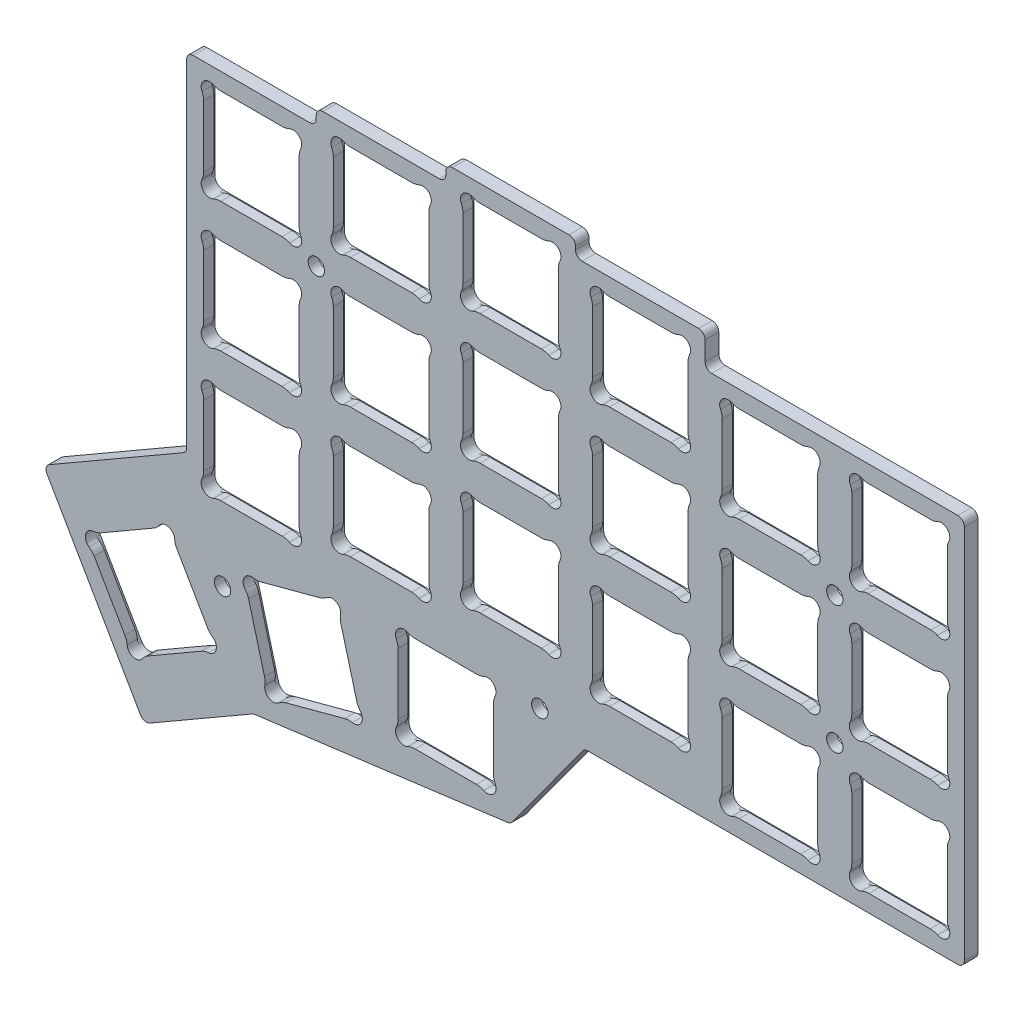
from build123d import *

# Parameters (mm, degrees)
SKETCH2_R           = 1.2
BOSS_EXTRUDE1_DEPTH = 2
FILLET1_R           = 2.5
SKETCH3_R           = 2
CUT_EXTRUDE1_DEPTH  = 0.5


with BuildPart() as part:
    # Sketch2 → Boss-Extrude1 (new body)
    with BuildSketch(Plane.XY):
        with BuildLine():
            ThreePointArc((3.358715952, 91.42556159), (2.678391323, 91.143761902), (2.396591635, 90.463437274))
            Line((2.396591635, 90.463437274), (2.396591635, 35.387693174))
            ThreePointArc((2.396591635, 35.387693174), (2.678391323, 34.707368546), (3.358715952, 34.425568858))
            Line((3.358715952, 34.425568858), (57.55538108, 34.425568858))
            ThreePointArc((57.55538108, 34.425568858), (57.991412266, 34.32109249), (58.332746845, 34.030353412))
            Line((58.332746845, 34.030353412), (68.6731028, 19.851286658))
            ThreePointArc((68.6731028, 19.851286658), (68.959916761, 19.590522811), (69.326358752, 19.464109602))
            Line((69.326358752, 19.464109602), (106.42211034, 14.638604201))
            ThreePointArc((106.42211034, 14.638604201), (106.606561986, 14.595821202), (106.779062685, 14.517742374))
            Line((106.779062685, 14.517742374), (121.831200494, 5.827386558))
            ThreePointArc((121.831200494, 5.827386558), (122.561278749, 5.731269932), (123.145486752, 6.1795485))
            Line((123.145486752, 6.1795485), (136.883362434, 29.974247168))
            ThreePointArc((136.883362434, 29.974247168), (136.979479059, 30.704325424), (136.531200492, 31.288533426))
            Line((136.531200492, 31.288533426), (116.881014221, 42.63357376))
            ThreePointArc((116.881014221, 42.63357376), (116.52885228, 42.985735701), (116.399952063, 43.466797859))
            Line((116.399952063, 43.466797859), (116.399952063, 92.828345033))
            ThreePointArc((116.399952063, 92.828345033), (116.118152375, 93.508669661), (115.437827746, 93.790469349))
            Line((115.437827746, 93.790469349), (98.360317754, 93.790469349))
            ThreePointArc((98.360317754, 93.790469349), (97.679993126, 94.072269037), (97.398193438, 94.752593666))
            Line((97.398193438, 94.752593666), (97.398193438, 95.213192117))
            ThreePointArc((97.398193438, 95.213192117), (97.11639375, 95.893516746), (96.436069121, 96.175316434))
            Line((96.436069121, 96.175316434), (79.359092742, 96.175316434))
            ThreePointArc((79.359092742, 96.175316434), (78.678768113, 96.457116122), (78.396968425, 97.137440751))
            Line((78.396968425, 97.137440751), (78.396968425, 97.587767164))
            ThreePointArc((78.396968425, 97.587767164), (78.115168737, 98.268091793), (77.434844109, 98.54989148))
            Line((77.434844109, 98.54989148), (60.359092745, 98.54989148))
            ThreePointArc((60.359092745, 98.54989148), (59.678768117, 98.268091793), (59.396968429, 97.587767164))
            Line((59.396968429, 97.587767164), (59.396968429, 97.133171852))
            ThreePointArc((59.396968429, 97.133171852), (59.115168741, 96.452847223), (58.434844112, 96.171047535))
            Line((58.434844112, 96.171047535), (41.357156249, 96.171047535))
            ThreePointArc((41.357156249, 96.171047535), (40.676831621, 95.889247847), (40.395031933, 95.208923218))
            Line((40.395031933, 95.208923218), (40.395031933, 92.387685907))
            ThreePointArc((40.395031933, 92.387685907), (40.113232245, 91.707361278), (39.432907616, 91.42556159))
            Line((39.432907616, 91.42556159), (3.358715952, 91.42556159))
        make_face()
        with BuildLine():
            ThreePointArc((17.128824679, 50.925568854), (18.012708155, 51.291685378), (18.896591632, 50.925568854))
            ThreePointArc((18.896591632, 50.925568854), (19.167557571, 50.520039668), (19.262708155, 50.041685378))
            ThreePointArc((19.262708155, 50.041685378), (19.167557571, 49.563331087), (18.896591632, 49.157801901))
            Line((18.896591632, 49.157801901), (18.896591632, 38.693335811))
            ThreePointArc((18.896591632, 38.693335811), (19.167557571, 38.287806624), (19.262708155, 37.809452334))
            ThreePointArc((19.262708155, 37.809452334), (19.167557571, 37.331098044), (18.896591632, 36.925568858))
            ThreePointArc((18.896591632, 36.925568858), (18.012708155, 36.559452334), (17.128824679, 36.925568858))
            Line((17.128824679, 36.925568858), (6.664358588, 36.925568858))
            ThreePointArc((6.664358588, 36.925568858), (5.780475112, 36.559452334), (4.896591635, 36.925568858))
            ThreePointArc((4.896591635, 36.925568858), (4.530475112, 37.809452334), (4.896591635, 38.693335811))
            Line((4.896591635, 38.693335811), (4.896591635, 49.157801901))
            ThreePointArc((4.896591635, 49.157801901), (4.530475112, 50.041685378), (4.896591635, 50.925568854))
            ThreePointArc((4.896591635, 50.925568854), (5.780475112, 51.291685378), (6.664358588, 50.925568854))
            Line((6.664358588, 50.925568854), (17.128824679, 50.925568854))
        make_face(mode=Mode.SUBTRACT)
        with BuildLine():
            ThreePointArc((25.662529929, 36.92624031), (24.778646452, 36.560123786), (23.894762976, 36.92624031))
            ThreePointArc((23.894762976, 36.92624031), (23.528646452, 37.810123786), (23.894762976, 38.694007263))
            Line((23.894762976, 38.694007263), (23.894762976, 49.158473353))
            ThreePointArc((23.894762976, 49.158473353), (23.528646452, 50.04235683), (23.894762976, 50.926240306))
            ThreePointArc((23.894762976, 50.926240306), (24.778646452, 51.29235683), (25.662529929, 50.926240306))
            Line((25.662529929, 50.926240306), (36.126996019, 50.926240306))
            ThreePointArc((36.126996019, 50.926240306), (37.010879496, 51.29235683), (37.894762972, 50.926240306))
            ThreePointArc((37.894762972, 50.926240306), (38.165728911, 50.52071112), (38.260879496, 50.04235683))
            ThreePointArc((38.260879496, 50.04235683), (38.165728911, 49.564002539), (37.894762972, 49.158473353))
            Line((37.894762972, 49.158473353), (37.894762972, 38.694007263))
            ThreePointArc((37.894762972, 38.694007263), (38.165728911, 38.288478077), (38.260879496, 37.810123786))
            ThreePointArc((38.260879496, 37.810123786), (38.165728911, 37.331769496), (37.894762972, 36.92624031))
            ThreePointArc((37.894762972, 36.92624031), (37.010879496, 36.560123786), (36.126996019, 36.92624031))
            Line((36.126996019, 36.92624031), (25.662529929, 36.92624031))
        make_face(mode=Mode.SUBTRACT)
        with Locations((64.637863533, 36.300090173)):
            Circle(SKETCH2_R, mode=Mode.SUBTRACT)
        with BuildLine():
            ThreePointArc((44.662798886, 41.671054802), (43.778915409, 41.304938279), (42.895031933, 41.671054802))
            ThreePointArc((42.895031933, 41.671054802), (42.528915409, 42.554938279), (42.895031933, 43.438821755))
            Line((42.895031933, 43.438821755), (42.895031933, 53.903287846))
            ThreePointArc((42.895031933, 53.903287846), (42.528915409, 54.787171322), (42.895031933, 55.671054799))
            ThreePointArc((42.895031933, 55.671054799), (43.778915409, 56.037171322), (44.662798886, 55.671054799))
            Line((44.662798886, 55.671054799), (55.127264976, 55.671054799))
            ThreePointArc((55.127264976, 55.671054799), (56.011148453, 56.037171322), (56.895031929, 55.671054799))
            ThreePointArc((56.895031929, 55.671054799), (57.165997868, 55.265525613), (57.261148453, 54.787171322))
            ThreePointArc((57.261148453, 54.787171322), (57.165997868, 54.308817032), (56.895031929, 53.903287846))
            Line((56.895031929, 53.903287846), (56.895031929, 43.438821755))
            ThreePointArc((56.895031929, 43.438821755), (57.165997868, 43.033292569), (57.261148453, 42.554938279))
            ThreePointArc((57.261148453, 42.554938279), (57.165997868, 42.076583988), (56.895031929, 41.671054802))
            ThreePointArc((56.895031929, 41.671054802), (56.011148453, 41.304938279), (55.127264976, 41.671054802))
            Line((55.127264976, 41.671054802), (44.662798886, 41.671054802))
        make_face(mode=Mode.SUBTRACT)
        with BuildLine():
            ThreePointArc((63.664735382, 44.049898748), (62.780851905, 43.683782224), (61.896968429, 44.049898748))
            ThreePointArc((61.896968429, 44.049898748), (61.530851905, 44.933782224), (61.896968429, 45.817665701))
            Line((61.896968429, 45.817665701), (61.896968429, 56.282131791))
            ThreePointArc((61.896968429, 56.282131791), (61.530851905, 57.166015268), (61.896968429, 58.049898744))
            ThreePointArc((61.896968429, 58.049898744), (62.780851905, 58.416015268), (63.664735382, 58.049898744))
            Line((63.664735382, 58.049898744), (74.129201472, 58.049898744))
            ThreePointArc((74.129201472, 58.049898744), (75.013084949, 58.416015268), (75.896968425, 58.049898744))
            ThreePointArc((75.896968425, 58.049898744), (76.167934364, 57.644369558), (76.263084949, 57.166015268))
            ThreePointArc((76.263084949, 57.166015268), (76.167934364, 56.687660977), (75.896968425, 56.282131791))
            Line((75.896968425, 56.282131791), (75.896968425, 45.817665701))
            ThreePointArc((75.896968425, 45.817665701), (76.167934364, 45.412136515), (76.263084949, 44.933782224))
            ThreePointArc((76.263084949, 44.933782224), (76.167934364, 44.455427934), (75.896968425, 44.049898748))
            ThreePointArc((75.896968425, 44.049898748), (75.013084949, 43.683782224), (74.129201472, 44.049898748))
            Line((74.129201472, 44.049898748), (63.664735382, 44.049898748))
        make_face(mode=Mode.SUBTRACT)
        with BuildLine():
            ThreePointArc((106.244867582, 31.71451574), (107.193391389, 31.839391268), (107.952399337, 31.256983985))
            ThreePointArc((107.952399337, 31.256983985), (108.077274865, 30.955507792), (108.119867582, 30.631983985))
            ThreePointArc((108.119867582, 30.631983985), (107.952399337, 30.006983985), (107.494867582, 29.549452231))
            Line((107.494867582, 29.549452231), (104.786464461, 19.441554176))
            ThreePointArc((104.786464461, 19.441554176), (104.911339989, 19.140077982), (104.953932707, 18.816554176))
            ThreePointArc((104.953932707, 18.816554176), (104.786464461, 18.191554176), (104.328932707, 17.734022421))
            ThreePointArc((104.328932707, 17.734022421), (103.3804089, 17.609146893), (102.621400952, 18.191554176))
            Line((102.621400952, 18.191554176), (92.513502897, 20.899957297))
            ThreePointArc((92.513502897, 20.899957297), (91.56497909, 20.775081768), (90.805971142, 21.357489051))
            ThreePointArc((90.805971142, 21.357489051), (90.681095614, 22.306012858), (91.263502897, 23.065020806))
            Line((91.263502897, 23.065020806), (93.971906018, 33.172918861))
            ThreePointArc((93.971906018, 33.172918861), (93.84703049, 34.121442668), (94.429437772, 34.880450616))
            ThreePointArc((94.429437772, 34.880450616), (95.377961579, 35.005326144), (96.136969527, 34.422918861))
            Line((96.136969527, 34.422918861), (106.244867582, 31.71451574))
        make_face(mode=Mode.SUBTRACT)
        with Locations((111.137845658, 28.550051811)):
            Circle(SKETCH2_R, mode=Mode.SUBTRACT)
        with BuildLine():
            ThreePointArc((113.605936524, 19.12102891), (112.657412717, 19.245904438), (112.075005434, 20.004912386))
            ThreePointArc((112.075005434, 20.004912386), (112.199880962, 20.953436193), (112.958888911, 21.535843475))
            Line((112.958888911, 21.535843475), (118.191121956, 30.598336947))
            ThreePointArc((118.191121956, 30.598336947), (118.315997484, 31.546860753), (119.075005433, 32.129268036))
            ThreePointArc((119.075005433, 32.129268036), (120.023529239, 32.004392508), (120.605936522, 31.24538456))
            Line((120.605936522, 31.24538456), (129.668429993, 26.013151514))
            ThreePointArc((129.668429993, 26.013151514), (130.6169538, 25.888275986), (131.199361083, 25.129268038))
            ThreePointArc((131.199361083, 25.129268038), (131.231259876, 24.968901972), (131.2419538, 24.805744231))
            ThreePointArc((131.2419538, 24.805744231), (130.983645475, 24.044792445), (130.315477606, 23.598336949))
            Line((130.315477606, 23.598336949), (125.083244561, 14.535843477))
            ThreePointArc((125.083244561, 14.535843477), (125.115143355, 14.375477411), (125.125837278, 14.212319671))
            ThreePointArc((125.125837278, 14.212319671), (124.867528953, 13.451367885), (124.199361084, 13.004912388))
            ThreePointArc((124.199361084, 13.004912388), (123.250837278, 13.129787916), (122.668429995, 13.888795864))
            Line((122.668429995, 13.888795864), (113.605936524, 19.12102891))
        make_face(mode=Mode.SUBTRACT)
        with BuildLine():
            ThreePointArc((83.648818986, 36.01741384), (84.532702463, 36.383530364), (85.416585939, 36.01741384))
            ThreePointArc((85.416585939, 36.01741384), (85.687551879, 35.611884654), (85.782702463, 35.133530364))
            ThreePointArc((85.782702463, 35.133530364), (85.687551879, 34.655176073), (85.416585939, 34.249646887))
            Line((85.416585939, 34.249646887), (85.416585939, 23.785180797))
            ThreePointArc((85.416585939, 23.785180797), (85.687551879, 23.379651611), (85.782702463, 22.90129732))
            ThreePointArc((85.782702463, 22.90129732), (85.687551879, 22.42294303), (85.416585939, 22.017413844))
            ThreePointArc((85.416585939, 22.017413844), (84.532702463, 21.65129732), (83.648818986, 22.017413844))
            Line((83.648818986, 22.017413844), (73.184352896, 22.017413844))
            ThreePointArc((73.184352896, 22.017413844), (72.300469419, 21.65129732), (71.416585943, 22.017413844))
            ThreePointArc((71.416585943, 22.017413844), (71.050469419, 22.90129732), (71.416585943, 23.785180797))
            Line((71.416585943, 23.785180797), (71.416585943, 34.249646887))
            ThreePointArc((71.416585943, 34.249646887), (71.050469419, 35.133530364), (71.416585943, 36.01741384))
            ThreePointArc((71.416585943, 36.01741384), (72.300469419, 36.383530364), (73.184352896, 36.01741384))
            Line((73.184352896, 36.01741384), (83.648818986, 36.01741384))
        make_face(mode=Mode.SUBTRACT)
        with BuildLine():
            ThreePointArc((82.665960394, 41.675323701), (81.782076918, 41.309207178), (80.898193441, 41.675323701))
            ThreePointArc((80.898193441, 41.675323701), (80.532076918, 42.559207178), (80.898193441, 43.443090654))
            Line((80.898193441, 43.443090654), (80.898193441, 53.907556745))
            ThreePointArc((80.898193441, 53.907556745), (80.532076918, 54.791440221), (80.898193441, 55.675323698))
            ThreePointArc((80.898193441, 55.675323698), (81.782076918, 56.041440221), (82.665960394, 55.675323698))
            Line((82.665960394, 55.675323698), (93.130426485, 55.675323698))
            ThreePointArc((93.130426485, 55.675323698), (94.014309961, 56.041440221), (94.898193438, 55.675323698))
            ThreePointArc((94.898193438, 55.675323698), (95.169159377, 55.269794512), (95.264309961, 54.791440221))
            ThreePointArc((95.264309961, 54.791440221), (95.169159377, 54.313085931), (94.898193438, 53.907556745))
            Line((94.898193438, 53.907556745), (94.898193438, 43.443090654))
            ThreePointArc((94.898193438, 43.443090654), (95.169159377, 43.037561468), (95.264309961, 42.559207178))
            ThreePointArc((95.264309961, 42.559207178), (95.169159377, 42.080852887), (94.898193438, 41.675323701))
            ThreePointArc((94.898193438, 41.675323701), (94.014309961, 41.309207178), (93.130426485, 41.675323701))
            Line((93.130426485, 41.675323701), (82.665960394, 41.675323701))
        make_face(mode=Mode.SUBTRACT)
        with BuildLine():
            ThreePointArc((101.667719019, 39.290476616), (100.783835543, 38.924360093), (99.899952066, 39.290476616))
            ThreePointArc((99.899952066, 39.290476616), (99.533835543, 40.174360093), (99.899952066, 41.058243569))
            Line((99.899952066, 41.058243569), (99.899952066, 51.52270966))
            ThreePointArc((99.899952066, 51.52270966), (99.533835543, 52.406593136), (99.899952066, 53.290476613))
            ThreePointArc((99.899952066, 53.290476613), (100.783835543, 53.656593136), (101.667719019, 53.290476613))
            Line((101.667719019, 53.290476613), (112.13218511, 53.290476613))
            ThreePointArc((112.13218511, 53.290476613), (113.016068586, 53.656593136), (113.899952063, 53.290476613))
            ThreePointArc((113.899952063, 53.290476613), (114.170918002, 52.884947427), (114.266068586, 52.406593136))
            ThreePointArc((114.266068586, 52.406593136), (114.170918002, 51.928238846), (113.899952063, 51.52270966))
            Line((113.899952063, 51.52270966), (113.899952063, 41.058243569))
            ThreePointArc((113.899952063, 41.058243569), (114.170918002, 40.652714383), (114.266068586, 40.174360093))
            ThreePointArc((114.266068586, 40.174360093), (114.170918002, 39.696005802), (113.899952063, 39.290476616))
            ThreePointArc((113.899952063, 39.290476616), (113.016068586, 38.924360093), (112.13218511, 39.290476616))
            Line((112.13218511, 39.290476616), (101.667719019, 39.290476616))
        make_face(mode=Mode.SUBTRACT)
        with BuildLine():
            ThreePointArc((6.664358588, 55.925568853), (5.780475112, 55.559452329), (4.896591635, 55.925568853))
            ThreePointArc((4.896591635, 55.925568853), (4.530475112, 56.809452329), (4.896591635, 57.693335806))
            Line((4.896591635, 57.693335806), (4.896591635, 68.157801896))
            ThreePointArc((4.896591635, 68.157801896), (4.530475112, 69.041685373), (4.896591635, 69.925568849))
            ThreePointArc((4.896591635, 69.925568849), (5.780475112, 70.291685373), (6.664358588, 69.925568849))
            Line((6.664358588, 69.925568849), (17.128824679, 69.925568849))
            ThreePointArc((17.128824679, 69.925568849), (18.012708155, 70.291685373), (18.896591632, 69.925568849))
            ThreePointArc((18.896591632, 69.925568849), (19.167557571, 69.520039663), (19.262708155, 69.041685373))
            ThreePointArc((19.262708155, 69.041685373), (19.167557571, 68.563331082), (18.896591632, 68.157801896))
            Line((18.896591632, 68.157801896), (18.896591632, 57.693335806))
            ThreePointArc((18.896591632, 57.693335806), (19.167557571, 57.28780662), (19.262708155, 56.809452329))
            ThreePointArc((19.262708155, 56.809452329), (19.167557571, 56.331098039), (18.896591632, 55.925568853))
            ThreePointArc((18.896591632, 55.925568853), (18.012708155, 55.559452329), (17.128824679, 55.925568853))
            Line((17.128824679, 55.925568853), (6.664358588, 55.925568853))
        make_face(mode=Mode.SUBTRACT)
        with Locations((21.387798276, 53.550235091)):
            Circle(SKETCH2_R, mode=Mode.SUBTRACT)
        with BuildLine():
            ThreePointArc((25.662529929, 55.926240305), (24.778646452, 55.560123781), (23.894762976, 55.926240305))
            ThreePointArc((23.894762976, 55.926240305), (23.528646452, 56.810123781), (23.894762976, 57.694007258))
            Line((23.894762976, 57.694007258), (23.894762976, 68.158473348))
            ThreePointArc((23.894762976, 68.158473348), (23.528646452, 69.042356825), (23.894762976, 69.926240301))
            ThreePointArc((23.894762976, 69.926240301), (24.778646452, 70.292356825), (25.662529929, 69.926240301))
            Line((25.662529929, 69.926240301), (36.126996019, 69.926240301))
            ThreePointArc((36.126996019, 69.926240301), (37.010879496, 70.292356825), (37.894762972, 69.926240301))
            ThreePointArc((37.894762972, 69.926240301), (38.165728911, 69.520711115), (38.260879496, 69.042356825))
            ThreePointArc((38.260879496, 69.042356825), (38.165728911, 68.564002534), (37.894762972, 68.158473348))
            Line((37.894762972, 68.158473348), (37.894762972, 57.694007258))
            ThreePointArc((37.894762972, 57.694007258), (38.165728911, 57.288478072), (38.260879496, 56.810123781))
            ThreePointArc((38.260879496, 56.810123781), (38.165728911, 56.331769491), (37.894762972, 55.926240305))
            ThreePointArc((37.894762972, 55.926240305), (37.010879496, 55.560123781), (36.126996019, 55.926240305))
            Line((36.126996019, 55.926240305), (25.662529929, 55.926240305))
        make_face(mode=Mode.SUBTRACT)
        with Locations((21.387798276, 72.300241098)):
            Circle(SKETCH2_R, mode=Mode.SUBTRACT)
        with BuildLine():
            ThreePointArc((44.662798886, 60.671054797), (43.778915409, 60.304938274), (42.895031933, 60.671054797))
            ThreePointArc((42.895031933, 60.671054797), (42.528915409, 61.554938274), (42.895031933, 62.43882175))
            Line((42.895031933, 62.43882175), (42.895031933, 72.903287841))
            ThreePointArc((42.895031933, 72.903287841), (42.528915409, 73.787171317), (42.895031933, 74.671054794))
            ThreePointArc((42.895031933, 74.671054794), (43.778915409, 75.037171317), (44.662798886, 74.671054794))
            Line((44.662798886, 74.671054794), (55.127264976, 74.671054794))
            ThreePointArc((55.127264976, 74.671054794), (56.011148453, 75.037171317), (56.895031929, 74.671054794))
            ThreePointArc((56.895031929, 74.671054794), (57.165997868, 74.265525608), (57.261148453, 73.787171317))
            ThreePointArc((57.261148453, 73.787171317), (57.165997868, 73.308817027), (56.895031929, 72.903287841))
            Line((56.895031929, 72.903287841), (56.895031929, 62.43882175))
            ThreePointArc((56.895031929, 62.43882175), (57.165997868, 62.033292564), (57.261148453, 61.554938274))
            ThreePointArc((57.261148453, 61.554938274), (57.165997868, 61.076583983), (56.895031929, 60.671054797))
            ThreePointArc((56.895031929, 60.671054797), (56.011148453, 60.304938274), (55.127264976, 60.671054797))
            Line((55.127264976, 60.671054797), (44.662798886, 60.671054797))
        make_face(mode=Mode.SUBTRACT)
        with BuildLine():
            ThreePointArc((63.664735382, 63.049898743), (62.780851905, 62.683782219), (61.896968429, 63.049898743))
            ThreePointArc((61.896968429, 63.049898743), (61.530851905, 63.933782219), (61.896968429, 64.817665696))
            Line((61.896968429, 64.817665696), (61.896968429, 75.282131786))
            ThreePointArc((61.896968429, 75.282131786), (61.530851905, 76.166015263), (61.896968429, 77.049898739))
            ThreePointArc((61.896968429, 77.049898739), (62.780851905, 77.416015263), (63.664735382, 77.049898739))
            Line((63.664735382, 77.049898739), (74.129201472, 77.049898739))
            ThreePointArc((74.129201472, 77.049898739), (75.013084949, 77.416015263), (75.896968425, 77.049898739))
            ThreePointArc((75.896968425, 77.049898739), (76.167934364, 76.644369553), (76.263084949, 76.166015263))
            ThreePointArc((76.263084949, 76.166015263), (76.167934364, 75.687660972), (75.896968425, 75.282131786))
            Line((75.896968425, 75.282131786), (75.896968425, 64.817665696))
            ThreePointArc((75.896968425, 64.817665696), (76.167934364, 64.41213651), (76.263084949, 63.933782219))
            ThreePointArc((76.263084949, 63.933782219), (76.167934364, 63.455427929), (75.896968425, 63.049898743))
            ThreePointArc((75.896968425, 63.049898743), (75.013084949, 62.683782219), (74.129201472, 63.049898743))
            Line((74.129201472, 63.049898743), (63.664735382, 63.049898743))
        make_face(mode=Mode.SUBTRACT)
        with BuildLine():
            ThreePointArc((17.436334559, 74.700259118), (16.988797184, 74.868419675), (16.514136804, 74.925561594))
            Line((16.514136804, 74.925561594), (7.279046463, 74.925561594))
            ThreePointArc((7.279046463, 74.925561594), (6.804386083, 74.868419675), (6.356848708, 74.700259118))
            ThreePointArc((6.356848708, 74.700259118), (4.896591635, 74.925561594), (4.671289159, 76.385818667))
            ThreePointArc((4.671289159, 76.385818667), (4.839449716, 76.833356042), (4.896591635, 77.308016421))
            Line((4.896591635, 77.308016421), (4.896591635, 86.543106763))
            ThreePointArc((4.896591635, 86.543106763), (4.839449716, 87.017767143), (4.671289159, 87.465304517))
            ThreePointArc((4.671289159, 87.465304517), (4.896591635, 88.92556159), (6.356848708, 89.150864066))
            ThreePointArc((6.356848708, 89.150864066), (6.804386083, 88.982703509), (7.279046463, 88.92556159))
            Line((7.279046463, 88.92556159), (16.514136804, 88.92556159))
            ThreePointArc((16.514136804, 88.92556159), (16.988797184, 88.982703509), (17.436334559, 89.150864066))
            ThreePointArc((17.436334559, 89.150864066), (18.896591632, 88.92556159), (19.121894108, 87.465304517))
            ThreePointArc((19.121894108, 87.465304517), (18.95373355, 87.017767143), (18.896591632, 86.543106763))
            Line((18.896591632, 86.543106763), (18.896591632, 77.308016421))
            ThreePointArc((18.896591632, 77.308016421), (18.95373355, 76.833356042), (19.121894108, 76.385818667))
            ThreePointArc((19.121894108, 76.385818667), (18.896591632, 74.925561594), (17.436334559, 74.700259118))
        make_face(mode=Mode.SUBTRACT)
        with BuildLine():
            ThreePointArc((23.894762976, 87.15846609), (23.528646452, 88.042349566), (23.894762976, 88.926233042))
            ThreePointArc((23.894762976, 88.926233042), (24.778646452, 89.292349566), (25.662529929, 88.926233042))
            Line((25.662529929, 88.926233042), (36.126996019, 88.926233042))
            ThreePointArc((36.126996019, 88.926233042), (37.010879496, 89.292349566), (37.894762972, 88.926233042))
            ThreePointArc((37.894762972, 88.926233042), (38.165728911, 88.520703856), (38.260879496, 88.042349566))
            ThreePointArc((38.260879496, 88.042349566), (38.165728911, 87.563995276), (37.894762972, 87.15846609))
            Line((37.894762972, 87.15846609), (37.894762972, 76.693999999))
            ThreePointArc((37.894762972, 76.693999999), (38.165728911, 76.288470813), (38.260879496, 75.810116522))
            ThreePointArc((38.260879496, 75.810116522), (38.165728911, 75.331762232), (37.894762972, 74.926233046))
            ThreePointArc((37.894762972, 74.926233046), (37.010879496, 74.560116522), (36.126996019, 74.926233046))
            Line((36.126996019, 74.926233046), (25.662529929, 74.926233046))
            ThreePointArc((25.662529929, 74.926233046), (24.778646452, 74.560116522), (23.894762976, 74.926233046))
            ThreePointArc((23.894762976, 74.926233046), (23.528646452, 75.810116522), (23.894762976, 76.693999999))
            Line((23.894762976, 76.693999999), (23.894762976, 87.15846609))
        make_face(mode=Mode.SUBTRACT)
        with BuildLine():
            ThreePointArc((44.662798886, 79.671047539), (43.778915409, 79.304931015), (42.895031933, 79.671047539))
            ThreePointArc((42.895031933, 79.671047539), (42.528915409, 80.554931015), (42.895031933, 81.438814491))
            Line((42.895031933, 81.438814491), (42.895031933, 91.903280582))
            ThreePointArc((42.895031933, 91.903280582), (42.528915409, 92.787164059), (42.895031933, 93.671047535))
            ThreePointArc((42.895031933, 93.671047535), (43.778915409, 94.037164059), (44.662798886, 93.671047535))
            Line((44.662798886, 93.671047535), (55.127264976, 93.671047535))
            ThreePointArc((55.127264976, 93.671047535), (56.011148453, 94.037164059), (56.895031929, 93.671047535))
            ThreePointArc((56.895031929, 93.671047535), (57.165997868, 93.265518349), (57.261148453, 92.787164059))
            ThreePointArc((57.261148453, 92.787164059), (57.165997868, 92.308809768), (56.895031929, 91.903280582))
            Line((56.895031929, 91.903280582), (56.895031929, 81.438814491))
            ThreePointArc((56.895031929, 81.438814491), (57.165997868, 81.033285305), (57.261148453, 80.554931015))
            ThreePointArc((57.261148453, 80.554931015), (57.165997868, 80.076576725), (56.895031929, 79.671047539))
            ThreePointArc((56.895031929, 79.671047539), (56.011148453, 79.304931015), (55.127264976, 79.671047539))
            Line((55.127264976, 79.671047539), (44.662798886, 79.671047539))
        make_face(mode=Mode.SUBTRACT)
        with BuildLine():
            ThreePointArc((63.664735382, 82.049891484), (62.780851905, 81.68377496), (61.896968429, 82.049891484))
            ThreePointArc((61.896968429, 82.049891484), (61.530851905, 82.93377496), (61.896968429, 83.817658437))
            Line((61.896968429, 83.817658437), (61.896968429, 94.282124528))
            ThreePointArc((61.896968429, 94.282124528), (61.530851905, 95.166008004), (61.896968429, 96.04989148))
            ThreePointArc((61.896968429, 96.04989148), (62.780851905, 96.416008004), (63.664735382, 96.04989148))
            Line((63.664735382, 96.04989148), (74.129201472, 96.04989148))
            ThreePointArc((74.129201472, 96.04989148), (75.013084949, 96.416008004), (75.896968425, 96.04989148))
            ThreePointArc((75.896968425, 96.04989148), (76.167934364, 95.644362294), (76.263084949, 95.166008004))
            ThreePointArc((76.263084949, 95.166008004), (76.167934364, 94.687653714), (75.896968425, 94.282124528))
            Line((75.896968425, 94.282124528), (75.896968425, 83.817658437))
            ThreePointArc((75.896968425, 83.817658437), (76.167934364, 83.412129251), (76.263084949, 82.93377496))
            ThreePointArc((76.263084949, 82.93377496), (76.167934364, 82.45542067), (75.896968425, 82.049891484))
            ThreePointArc((75.896968425, 82.049891484), (75.013084949, 81.68377496), (74.129201472, 82.049891484))
            Line((74.129201472, 82.049891484), (63.664735382, 82.049891484))
        make_face(mode=Mode.SUBTRACT)
        with BuildLine():
            ThreePointArc((93.130426485, 74.675323693), (94.014309961, 75.041440216), (94.898193438, 74.675323693))
            ThreePointArc((94.898193438, 74.675323693), (95.169159377, 74.269794507), (95.264309961, 73.791440216))
            ThreePointArc((95.264309961, 73.791440216), (95.169159377, 73.313085926), (94.898193438, 72.90755674))
            Line((94.898193438, 72.90755674), (94.898193438, 62.443090649))
            ThreePointArc((94.898193438, 62.443090649), (95.169159377, 62.037561463), (95.264309961, 61.559207173))
            ThreePointArc((95.264309961, 61.559207173), (95.169159377, 61.080852882), (94.898193438, 60.675323696))
            ThreePointArc((94.898193438, 60.675323696), (94.014309961, 60.309207173), (93.130426485, 60.675323696))
            Line((93.130426485, 60.675323696), (82.665960394, 60.675323696))
            ThreePointArc((82.665960394, 60.675323696), (81.782076918, 60.309207173), (80.898193441, 60.675323696))
            ThreePointArc((80.898193441, 60.675323696), (80.532076918, 61.559207173), (80.898193441, 62.443090649))
            Line((80.898193441, 62.443090649), (80.898193441, 72.90755674))
            ThreePointArc((80.898193441, 72.90755674), (80.532076918, 73.791440216), (80.898193441, 74.675323693))
            ThreePointArc((80.898193441, 74.675323693), (81.782076918, 75.041440216), (82.665960394, 74.675323693))
            Line((82.665960394, 74.675323693), (93.130426485, 74.675323693))
        make_face(mode=Mode.SUBTRACT)
        with BuildLine():
            ThreePointArc((101.667719019, 58.290476612), (100.783835543, 57.924360088), (99.899952066, 58.290476612))
            ThreePointArc((99.899952066, 58.290476612), (99.533835543, 59.174360088), (99.899952066, 60.058243565))
            Line((99.899952066, 60.058243565), (99.899952066, 70.522709655))
            ThreePointArc((99.899952066, 70.522709655), (99.533835543, 71.406593132), (99.899952066, 72.290476608))
            ThreePointArc((99.899952066, 72.290476608), (100.783835543, 72.656593132), (101.667719019, 72.290476608))
            Line((101.667719019, 72.290476608), (112.13218511, 72.290476608))
            ThreePointArc((112.13218511, 72.290476608), (113.016068586, 72.656593132), (113.899952063, 72.290476608))
            ThreePointArc((113.899952063, 72.290476608), (114.170918002, 71.884947422), (114.266068586, 71.406593132))
            ThreePointArc((114.266068586, 71.406593132), (114.170918002, 70.928238841), (113.899952063, 70.522709655))
            Line((113.899952063, 70.522709655), (113.899952063, 60.058243565))
            ThreePointArc((113.899952063, 60.058243565), (114.170918002, 59.652714379), (114.266068586, 59.174360088))
            ThreePointArc((114.266068586, 59.174360088), (114.170918002, 58.696005798), (113.899952063, 58.290476612))
            ThreePointArc((113.899952063, 58.290476612), (113.016068586, 57.924360088), (112.13218511, 58.290476612))
            Line((112.13218511, 58.290476612), (101.667719019, 58.290476612))
        make_face(mode=Mode.SUBTRACT)
        with Locations((97.387827206, 76.050038887)):
            Circle(SKETCH2_R, mode=Mode.SUBTRACT)
        with BuildLine():
            ThreePointArc((82.665960394, 79.675316437), (81.782076918, 79.309199914), (80.898193441, 79.675316437))
            ThreePointArc((80.898193441, 79.675316437), (80.532076918, 80.559199914), (80.898193441, 81.44308339))
            Line((80.898193441, 81.44308339), (80.898193441, 91.907549481))
            ThreePointArc((80.898193441, 91.907549481), (80.532076918, 92.791432957), (80.898193441, 93.675316434))
            ThreePointArc((80.898193441, 93.675316434), (81.782076918, 94.041432957), (82.665960394, 93.675316434))
            Line((82.665960394, 93.675316434), (93.130426485, 93.675316434))
            ThreePointArc((93.130426485, 93.675316434), (94.014309961, 94.041432957), (94.898193438, 93.675316434))
            ThreePointArc((94.898193438, 93.675316434), (95.169159377, 93.269787248), (95.264309961, 92.791432957))
            ThreePointArc((95.264309961, 92.791432957), (95.169159377, 92.313078667), (94.898193438, 91.907549481))
            Line((94.898193438, 91.907549481), (94.898193438, 81.44308339))
            ThreePointArc((94.898193438, 81.44308339), (95.169159377, 81.037554204), (95.264309961, 80.559199914))
            ThreePointArc((95.264309961, 80.559199914), (95.169159377, 80.080845624), (94.898193438, 79.675316437))
            ThreePointArc((94.898193438, 79.675316437), (94.014309961, 79.309199914), (93.130426485, 79.675316437))
            Line((93.130426485, 79.675316437), (82.665960394, 79.675316437))
        make_face(mode=Mode.SUBTRACT)
        with BuildLine():
            ThreePointArc((101.667719019, 77.290469353), (100.783835543, 76.924352829), (99.899952066, 77.290469353))
            ThreePointArc((99.899952066, 77.290469353), (99.533835543, 78.174352829), (99.899952066, 79.058236306))
            Line((99.899952066, 79.058236306), (99.899952066, 89.522702396))
            ThreePointArc((99.899952066, 89.522702396), (99.533835543, 90.406585873), (99.899952066, 91.290469349))
            ThreePointArc((99.899952066, 91.290469349), (100.783835543, 91.656585873), (101.667719019, 91.290469349))
            Line((101.667719019, 91.290469349), (112.13218511, 91.290469349))
            ThreePointArc((112.13218511, 91.290469349), (113.016068586, 91.656585873), (113.899952063, 91.290469349))
            ThreePointArc((113.899952063, 91.290469349), (114.170918002, 90.884940163), (114.266068586, 90.406585873))
            ThreePointArc((114.266068586, 90.406585873), (114.170918002, 89.928231582), (113.899952063, 89.522702396))
            Line((113.899952063, 89.522702396), (113.899952063, 79.058236306))
            ThreePointArc((113.899952063, 79.058236306), (114.170918002, 78.65270712), (114.266068586, 78.174352829))
            ThreePointArc((114.266068586, 78.174352829), (114.170918002, 77.695998539), (113.899952063, 77.290469353))
            ThreePointArc((113.899952063, 77.290469353), (113.016068586, 76.924352829), (112.13218511, 77.290469353))
            Line((112.13218511, 77.290469353), (101.667719019, 77.290469353))
        make_face(mode=Mode.SUBTRACT)
    extrude(amount=BOSS_EXTRUDE1_DEPTH)

    # Fillet1
    fillet1_edges = [part.edges().sort_by_distance(p)[0] for p in [
        (44.662798886, 79.671047539, 1),
        (42.895031933, 81.438814491, 1),
        (55.127264976, 79.671047539, 1),
        (56.895031929, 81.438814491, 1),
        (56.895031929, 91.903280582, 1),
        (55.127264976, 93.671047535, 1),
        (42.895031933, 91.903280582, 1),
        (44.662798886, 93.671047535, 1),
        (37.894762972, 76.693999999, 1),
        (37.894762972, 87.15846609, 1),
        (36.126996019, 88.926233042, 1),
        (25.662529929, 88.926233042, 1),
        (36.126996019, 74.926233046, 1),
        (25.662529929, 74.926233046, 1),
        (23.894762976, 76.693999999, 1),
        (23.894762976, 87.15846609, 1),
        (74.129201472, 96.04989148, 1),
        (75.896968425, 94.282124528, 1),
        (75.896968425, 83.817658437, 1),
        (74.129201472, 82.049891484, 1),
        (63.664735382, 96.04989148, 1),
        (63.664735382, 82.049891484, 1),
        (61.896968429, 83.817658437, 1),
        (61.896968429, 94.282124528, 1),
        (55.127264976, 55.671054799, 1),
        (56.895031929, 53.903287846, 1),
        (44.662798886, 55.671054799, 1),
        (42.895031933, 53.903287846, 1),
        (42.895031933, 43.438821755, 1),
        (44.662798886, 41.671054802, 1),
        (56.895031929, 43.438821755, 1),
        (55.127264976, 41.671054802, 1),
        (25.662529929, 50.926240306, 1),
        (23.894762976, 49.158473353, 1),
        (36.126996019, 50.926240306, 1),
        (37.894762972, 49.158473353, 1),
        (37.894762972, 38.694007263, 1),
        (36.126996019, 36.92624031, 1),
        (23.894762976, 38.694007263, 1),
        (25.662529929, 36.92624031, 1),
        (17.128824679, 50.925568854, 1),
        (18.896591632, 49.157801901, 1),
        (6.664358588, 50.925568854, 1),
        (4.896591635, 49.157801901, 1),
        (4.896591635, 38.693335811, 1),
        (6.664358588, 36.925568858, 1),
        (17.128824679, 36.925568858, 1),
        (18.896591632, 38.693335811, 1),
        (6.664358588, 69.925568849, 1),
        (4.896591635, 68.157801896, 1),
        (4.896591635, 57.693335806, 1),
        (6.664358588, 55.925568853, 1),
        (17.128824679, 55.925568853, 1),
        (18.896591632, 57.693335806, 1),
        (17.128824679, 69.925568849, 1),
        (18.896591632, 68.157801896, 1),
        (23.894762976, 68.158473348, 1),
        (25.662529929, 69.926240301, 1),
        (23.894762976, 57.694007258, 1),
        (25.662529929, 55.926240305, 1),
        (36.126996019, 55.926240305, 1),
        (37.894762972, 57.694007258, 1),
        (36.126996019, 69.926240301, 1),
        (37.894762972, 68.158473348, 1),
        (42.895031933, 62.43882175, 1),
        (44.662798886, 60.671054797, 1),
        (55.127264976, 60.671054797, 1),
        (56.895031929, 62.43882175, 1),
        (42.895031933, 72.903287841, 1),
        (44.662798886, 74.671054794, 1),
        (55.127264976, 74.671054794, 1),
        (56.895031929, 72.903287841, 1),
        (74.129201472, 77.049898739, 1),
        (63.664735382, 77.049898739, 1),
        (61.896968429, 75.282131786, 1),
        (61.896968429, 64.817665696, 1),
        (63.664735382, 63.049898743, 1),
        (74.129201472, 63.049898743, 1),
        (75.896968425, 64.817665696, 1),
        (75.896968425, 75.282131786, 1),
        (63.664735382, 58.049898744, 1),
        (61.896968429, 56.282131791, 1),
        (61.896968429, 45.817665701, 1),
        (63.664735382, 44.049898748, 1),
        (74.129201472, 58.049898744, 1),
        (75.896968425, 56.282131791, 1),
        (74.129201472, 44.049898748, 1),
        (75.896968425, 45.817665701, 1),
        (71.416585943, 23.785180797, 1),
        (73.184352896, 22.017413844, 1),
        (71.416585943, 34.249646887, 1),
        (73.184352896, 36.01741384, 1),
        (83.648818986, 36.01741384, 1),
        (85.416585939, 34.249646887, 1),
        (93.130426485, 55.675323698, 1),
        (82.665960394, 55.675323698, 1),
        (80.898193441, 53.907556745, 1),
        (80.898193441, 43.443090654, 1),
        (82.665960394, 41.675323701, 1),
        (93.130426485, 41.675323701, 1),
        (94.898193438, 43.443090654, 1),
        (94.898193438, 53.907556745, 1),
        (82.665960394, 74.675323693, 1),
        (80.898193441, 72.90755674, 1),
        (80.898193441, 62.443090649, 1),
        (82.665960394, 60.675323696, 1),
        (93.130426485, 60.675323696, 1),
        (94.898193438, 62.443090649, 1),
        (93.130426485, 74.675323693, 1),
        (94.898193438, 72.90755674, 1),
        (102.621400952, 18.191554176, 1),
        (83.648818986, 22.017413844, 1),
        (85.416585939, 23.785180797, 1),
        (92.513502897, 20.899957297, 1),
        (91.263502897, 23.065020806, 1),
        (93.971906018, 33.172918861, 1),
        (96.136969527, 34.422918861, 1),
        (107.494867582, 29.549452231, 1),
        (106.244867582, 31.71451574, 1),
        (112.958888911, 21.535843475, 1),
        (113.605936524, 19.12102891, 1),
        (122.668429995, 13.888795864, 1),
        (125.083244561, 14.535843477, 1),
        (130.315477606, 23.598336949, 1),
        (129.668429993, 26.013151514, 1),
        (120.605936522, 31.24538456, 1),
        (118.191121956, 30.598336947, 1),
        (101.667719019, 39.290476616, 1),
        (99.899952066, 41.058243569, 1),
        (112.13218511, 39.290476616, 1),
        (113.899952063, 41.058243569, 1),
        (113.899952063, 51.52270966, 1),
        (112.13218511, 53.290476613, 1),
        (99.899952066, 51.52270966, 1),
        (101.667719019, 53.290476613, 1),
        (99.899952066, 60.058243565, 1),
        (101.667719019, 58.290476612, 1),
        (112.13218511, 58.290476612, 1),
        (113.899952063, 60.058243565, 1),
        (113.899952063, 70.522709655, 1),
        (112.13218511, 72.290476608, 1),
        (101.667719019, 72.290476608, 1),
        (99.899952066, 70.522709655, 1),
        (101.667719019, 77.290469353, 1),
        (99.899952066, 79.058236306, 1),
        (112.13218511, 77.290469353, 1),
        (113.899952063, 79.058236306, 1),
        (113.899952063, 89.522702396, 1),
        (112.13218511, 91.290469349, 1),
        (99.899952066, 89.522702396, 1),
        (101.667719019, 91.290469349, 1),
        (93.130426485, 93.675316434, 1),
        (94.898193438, 91.907549481, 1),
        (94.898193438, 81.44308339, 1),
        (93.130426485, 79.675316437, 1),
        (82.665960394, 79.675316437, 1),
        (80.898193441, 91.907549481, 1),
        (80.898193441, 81.44308339, 1),
        (82.665960394, 93.675316434, 1),
        (104.786464461, 19.441554176, 1),
    ]]
    fillet(fillet1_edges, radius=FILLET1_R)

    # Sketch3 → Cut-Extrude1 (cut)
    with BuildSketch(Plane.XY):
        with Locations((64.637863533, 36.300090173)):
            Circle(SKETCH3_R)
        with Locations((97.387827206, 76.050038887)):
            Circle(SKETCH3_R)
        with Locations((111.137845658, 28.550051811)):
            Circle(SKETCH3_R)
        with Locations((21.387798276, 72.300241098)):
            Circle(SKETCH3_R)
        with Locations((21.387798276, 53.550235091)):
            Circle(SKETCH3_R)
        Polygon((100.783835543, 90.406585873), (99.533835543, 90.406585873), (99.533835543, 78.174352829), (100.783835543, 78.174352829), (100.783835543, 76.924352829), (113.016068586, 76.924352829), (113.016068586, 78.174352829), (114.266068586, 78.174352829), (114.266068586, 90.406585873), (113.016068586, 90.406585873), (113.016068586, 91.656585873), (100.783835543, 91.656585873), align=None)
        Polygon((94.014309961, 92.791432957), (95.264309961, 92.791432957), (95.264309961, 80.559199914), (94.014309961, 80.559199914), (94.014309961, 79.309199914), (81.782076918, 79.309199914), (81.782076918, 80.559199914), (80.532076918, 80.559199914), (80.532076918, 92.791432957), (81.782076918, 92.791432957), (81.782076918, 94.041432957), (94.014309961, 94.041432957), align=None)
        Polygon((75.013084949, 95.166008004), (76.263084949, 95.166008004), (76.263084949, 82.93377496), (75.013084949, 82.93377496), (75.013084949, 81.68377496), (62.780851905, 81.68377496), (62.780851905, 82.93377496), (61.530851905, 82.93377496), (61.530851905, 95.166008004), (62.780851905, 95.166008004), (62.780851905, 96.416008004), (75.013084949, 96.416008004), align=None)
        Polygon((56.011148453, 94.037164059), (43.778915409, 94.037164059), (43.778915409, 92.787164059), (42.528915409, 92.787164059), (42.528915409, 80.554931015), (43.778915409, 80.554931015), (43.778915409, 79.304931015), (56.011148453, 79.304931015), (56.011148453, 80.554931015), (57.261148453, 80.554931015), (57.261148453, 92.787164059), (56.011148453, 92.787164059), align=None)
        Polygon((37.010879496, 88.042349566), (38.260879496, 88.042349566), (38.260879496, 75.810116522), (37.010879496, 75.810116522), (37.010879496, 74.560116522), (24.778646452, 74.560116522), (24.778646452, 75.810116522), (23.528646452, 75.810116522), (23.528646452, 88.042349566), (24.778646452, 88.042349566), (24.778646452, 89.292349566), (37.010879496, 89.292349566), align=None)
        Polygon((18.012708155, 88.041678114), (19.262708155, 88.041678114), (19.262708155, 75.80944507), (18.012708155, 75.80944507), (18.012708155, 74.55944507), (5.780475112, 74.55944507), (5.780475112, 75.80944507), (4.530475112, 75.80944507), (4.530475112, 88.041678114), (5.780475112, 88.041678114), (5.780475112, 89.291678114), (18.012708155, 89.291678114), align=None)
        Polygon((18.012708155, 69.041685373), (19.262708155, 69.041685373), (19.262708155, 56.809452329), (18.012708155, 56.809452329), (18.012708155, 55.559452329), (5.780475112, 55.559452329), (5.780475112, 56.809452329), (4.530475112, 56.809452329), (4.530475112, 69.041685373), (5.780475112, 69.041685373), (5.780475112, 70.291685373), (18.012708155, 70.291685373), align=None)
        Polygon((24.778646452, 70.292356825), (37.010879496, 70.292356825), (37.010879496, 69.042356825), (38.260879496, 69.042356825), (38.260879496, 56.810123781), (37.010879496, 56.810123781), (37.010879496, 55.560123781), (24.778646452, 55.560123781), (24.778646452, 56.810123781), (23.528646452, 56.810123781), (23.528646452, 69.042356825), (24.778646452, 69.042356825), align=None)
        Polygon((18.012708155, 50.041685378), (19.262708155, 50.041685378), (19.262708155, 37.809452334), (18.012708155, 37.809452334), (18.012708155, 36.559452334), (5.780475112, 36.559452334), (5.780475112, 37.809452334), (4.530475112, 37.809452334), (4.530475112, 50.041685378), (5.780475112, 50.041685378), (5.780475112, 51.291685378), (18.012708155, 51.291685378), align=None)
        Polygon((24.778646452, 51.29235683), (37.010879496, 51.29235683), (37.010879496, 50.04235683), (38.260879496, 50.04235683), (38.260879496, 37.810123786), (37.010879496, 37.810123786), (37.010879496, 36.560123786), (24.778646452, 36.560123786), (24.778646452, 37.810123786), (23.528646452, 37.810123786), (23.528646452, 50.04235683), (24.778646452, 50.04235683), align=None)
        Polygon((56.011148453, 73.787171317), (57.261148453, 73.787171317), (57.261148453, 61.554938274), (56.011148453, 61.554938274), (56.011148453, 60.304938274), (43.778915409, 60.304938274), (43.778915409, 61.554938274), (42.528915409, 61.554938274), (42.528915409, 73.787171317), (43.778915409, 73.787171317), (43.778915409, 75.037171317), (56.011148453, 75.037171317), align=None)
        Polygon((56.011148453, 56.037171322), (43.778915409, 56.037171322), (43.778915409, 54.787171322), (42.528915409, 54.787171322), (42.528915409, 42.554938279), (43.778915409, 42.554938279), (43.778915409, 41.304938279), (56.011148453, 41.304938279), (56.011148453, 42.554938279), (57.261148453, 42.554938279), (57.261148453, 54.787171322), (56.011148453, 54.787171322), align=None)
        Polygon((75.013084949, 76.166015263), (76.263084949, 76.166015263), (76.263084949, 63.933782219), (75.013084949, 63.933782219), (75.013084949, 62.683782219), (62.780851905, 62.683782219), (62.780851905, 63.933782219), (61.530851905, 63.933782219), (61.530851905, 76.166015263), (62.780851905, 76.166015263), (62.780851905, 77.416015263), (75.013084949, 77.416015263), align=None)
        Polygon((75.013084949, 58.416015268), (62.780851905, 58.416015268), (62.780851905, 57.166015268), (61.530851905, 57.166015268), (61.530851905, 44.933782224), (62.780851905, 44.933782224), (62.780851905, 43.683782224), (75.013084949, 43.683782224), (75.013084949, 44.933782224), (76.263084949, 44.933782224), (76.263084949, 57.166015268), (75.013084949, 57.166015268), align=None)
        Polygon((81.782076918, 73.791440216), (80.532076918, 73.791440216), (80.532076918, 61.559207173), (81.782076918, 61.559207173), (81.782076918, 60.309207173), (94.014309961, 60.309207173), (94.014309961, 61.559207173), (95.264309961, 61.559207173), (95.264309961, 73.791440216), (94.014309961, 73.791440216), (94.014309961, 75.041440216), (81.782076918, 75.041440216), align=None)
        Polygon((94.014309961, 54.791440221), (95.264309961, 54.791440221), (95.264309961, 42.559207178), (94.014309961, 42.559207178), (94.014309961, 41.309207178), (81.782076918, 41.309207178), (81.782076918, 42.559207178), (80.532076918, 42.559207178), (80.532076918, 54.791440221), (81.782076918, 54.791440221), (81.782076918, 56.041440221), (94.014309961, 56.041440221), align=None)
        Polygon((113.016068586, 71.406593132), (114.266068586, 71.406593132), (114.266068586, 59.174360088), (113.016068586, 59.174360088), (113.016068586, 57.924360088), (100.783835543, 57.924360088), (100.783835543, 59.174360088), (99.533835543, 59.174360088), (99.533835543, 71.406593132), (100.783835543, 71.406593132), (100.783835543, 72.656593132), (113.016068586, 72.656593132), align=None)
        Polygon((113.016068586, 53.656593136), (100.783835543, 53.656593136), (100.783835543, 52.406593136), (99.533835543, 52.406593136), (99.533835543, 40.174360093), (100.783835543, 40.174360093), (100.783835543, 38.924360093), (113.016068586, 38.924360093), (113.016068586, 40.174360093), (114.266068586, 40.174360093), (114.266068586, 52.406593136), (113.016068586, 52.406593136), align=None)
        Polygon((84.532702463, 35.133530364), (85.782702463, 35.133530364), (85.782702463, 22.90129732), (84.532702463, 22.90129732), (84.532702463, 21.65129732), (72.300469419, 21.65129732), (72.300469419, 22.90129732), (71.050469419, 22.90129732), (71.050469419, 35.133530364), (72.300469419, 35.133530364), (72.300469419, 36.383530364), (84.532702463, 36.383530364), align=None)
        Polygon((108.077274865, 30.308460179), (104.911339989, 18.493030369), (103.3804089, 17.609146893), (91.56497909, 20.775081768), (90.681095614, 22.306012858), (93.84703049, 34.121442668), (95.377961579, 35.005326144), (107.193391389, 31.839391268), align=None)
        Polygon((131.074485554, 24.180744231), (124.958369033, 13.587319671), (123.250837278, 13.129787916), (112.657412717, 19.245904438), (112.199880962, 20.953436193), (118.315997484, 31.546860753), (120.023529239, 32.004392508), (130.6169538, 25.888275986), align=None)
    extrude(amount=CUT_EXTRUDE1_DEPTH, mode=Mode.SUBTRACT)


with BuildPart() as body_2:
    # Mirror1: mirrored copy
    add(part.part.mirror(Plane(origin=(2.396591635, 0, 2), x_dir=(0, 0, 1), z_dir=(1, 0, 0))))


solid = body_2.part
